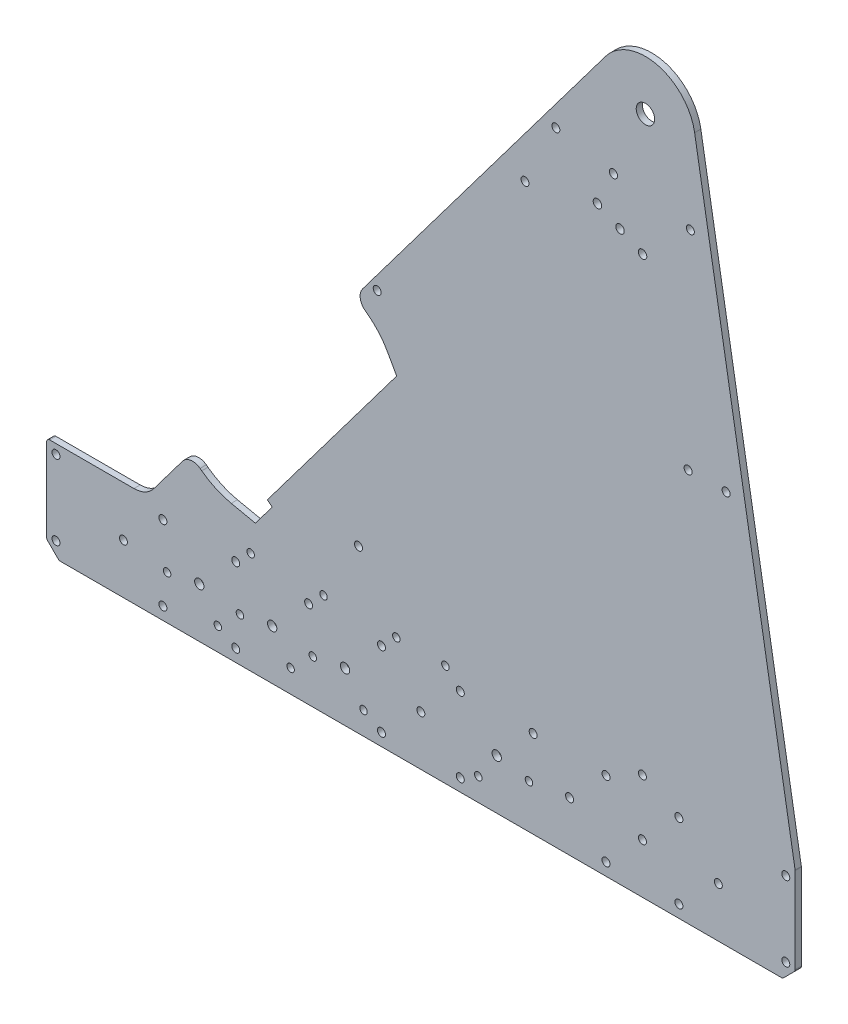
from build123d import *

# Parameters (mm, degrees)
BOSS_EXTRUDE1_DEPTH = 3.175
CUT_EXTRUDE1_REACH  = 534.132
SKETCH2_R           = 2.032
SKETCH5_R           = 2.032
SKETCH5_R_2         = 2.38125
CUT_EXTRUDE4_DEPTH  = 533.132273265
SKETCH6_R           = 2.032
CUT_EXTRUDE5_DEPTH  = 533.132273265
SKETCH3_R           = 4.699
SKETCH3_R_2         = 2.032
SKETCH3_R_3         = 2.0955
SKETCH3_R_4         = 2.159
CUT_EXTRUDE2_DEPTH  = 533.132273265
FILLET1_R           = 1.5875
CUT_EXTRUDE3_REACH  = 534.132
SKETCH4_R           = 1.905
FILLET2_R           = 38.1
FILLET3_R           = 6.35


with BuildPart() as part:
    # Sketch1 → Boss-Extrude1 (new body)
    with BuildSketch(Plane.XY):
        with BuildLine():
            Line((0, 0), (381, 0))
            Line((381, 0), (381, 50.8))
            Line((381, 50.8), (329.837432577, 350.351326687))
            ThreePointArc((329.837432577, 350.351326687), (310.787920632, 370.759100277), (284.504927721, 361.348180455))
            Line((284.504927721, 361.348180455), (157.027492501, 191.955579526))
            Line((157.027492501, 191.955579526), (169.711912675, 182.409841741))
            Line((169.711912675, 182.409841741), (178.167615548, 167.244965001))
            Line((178.167615548, 167.244965001), (112.326505112, 79.754995301))
            Line((112.326505112, 79.754995301), (114.863389147, 77.845847744))
            Line((114.863389147, 77.845847744), (106.272225141, 66.429869588))
            Line((106.272225141, 66.429869588), (85.709420174, 70.786944209))
            Line((85.709420174, 70.786944209), (73.025, 80.332681993))
            Line((73.025, 80.332681993), (54.610499914, 55.863409773))
            ThreePointArc((54.610499914, 55.863409773), (50.133294634, 52.136138511), (44.462963775, 50.8))
            Line((44.462963775, 50.8), (0, 50.8))
            Line((0, 50.8), (0, 0))
        make_face()
    extrude(amount=BOSS_EXTRUDE1_DEPTH)

    # Sketch2 → Cut-Extrude1 (cut, up to next)
    with BuildSketch(Plane.XY.offset(3.175), mode=Mode.PRIVATE) as cut_extrude1_sk1:
        with Locations((4.7625, 46.0375)):
            Circle(SKETCH2_R)
    cut_extrude1_tool1 = extrude(cut_extrude1_sk1.sketch, amount=-CUT_EXTRUDE1_REACH, mode=Mode.PRIVATE) & part.part
    # Sketch2 → Cut-Extrude1 (cut, up to next)
    with BuildSketch(Plane.XY.offset(3.175), mode=Mode.PRIVATE) as cut_extrude1_sk2:
        with Locations((4.7625, 7.9375)):
            Circle(SKETCH2_R)
    cut_extrude1_tool2 = extrude(cut_extrude1_sk2.sketch, amount=-CUT_EXTRUDE1_REACH, mode=Mode.PRIVATE) & part.part
    # Sketch2 → Cut-Extrude1 (cut, up to next)
    with BuildSketch(Plane.XY.offset(3.175), mode=Mode.PRIVATE) as cut_extrude1_sk3:
        with Locations((376.2375, 7.9375)):
            Circle(SKETCH2_R)
    cut_extrude1_tool3 = extrude(cut_extrude1_sk3.sketch, amount=-CUT_EXTRUDE1_REACH, mode=Mode.PRIVATE) & part.part
    # Sketch2 → Cut-Extrude1 (cut, up to next)
    with BuildSketch(Plane.XY.offset(3.175), mode=Mode.PRIVATE) as cut_extrude1_sk4:
        with Locations((376.2375, 46.0375)):
            Circle(SKETCH2_R)
    cut_extrude1_tool4 = extrude(cut_extrude1_sk4.sketch, amount=-CUT_EXTRUDE1_REACH, mode=Mode.PRIVATE) & part.part
    # Sketch2 → Cut-Extrude1 (cut, up to next)
    with BuildSketch(Plane.XY.offset(3.175), mode=Mode.PRIVATE) as cut_extrude1_sk5:
        Polygon((0, 6.35), (0, 0), (6.35, 0), align=None)
    cut_extrude1_tool5 = extrude(cut_extrude1_sk5.sketch, amount=-CUT_EXTRUDE1_REACH, mode=Mode.PRIVATE) & part.part
    # Sketch2 → Cut-Extrude1 (cut, up to next)
    with BuildSketch(Plane.XY.offset(3.175), mode=Mode.PRIVATE) as cut_extrude1_sk6:
        Polygon((381, 0), (374.65, 0), (381, 6.35), align=None)
    cut_extrude1_tool6 = extrude(cut_extrude1_sk6.sketch, amount=-CUT_EXTRUDE1_REACH, mode=Mode.PRIVATE) & part.part
    add(cut_extrude1_tool1.solids().sort_by_distance((4.7625, 46.0375, 3.175))[0], mode=Mode.SUBTRACT)
    add(cut_extrude1_tool2.solids().sort_by_distance((4.7625, 7.9375, 3.175))[0], mode=Mode.SUBTRACT)
    add(cut_extrude1_tool3.solids().sort_by_distance((376.2375, 7.9375, 3.175))[0], mode=Mode.SUBTRACT)
    add(cut_extrude1_tool4.solids().sort_by_distance((376.2375, 46.0375, 3.175))[0], mode=Mode.SUBTRACT)
    add(cut_extrude1_tool5.solids().sort_by_distance((2.116667, 2.116667, 3.175))[0], mode=Mode.SUBTRACT)
    add(cut_extrude1_tool6.solids().sort_by_distance((378.883333, 2.116667, 3.175))[0], mode=Mode.SUBTRACT)

    # Sketch5 → Cut-Extrude4 (cut, through all)
    with BuildSketch(Plane.XY.offset(3.175)):
        with Locations((39.116, 25.4)):
            Circle(SKETCH5_R)
        with Locations((59.182, 6.35)):
            Circle(SKETCH5_R)
        with Locations((59.182, 44.45)):
            Circle(SKETCH5_R)
        with Locations((96.266, 44.45)):
            Circle(SKETCH5_R)
        with Locations((133.35, 44.45)):
            Circle(SKETCH5_R)
        with Locations((170.434, 44.45)):
            Circle(SKETCH5_R)
        with Locations((210.566, 44.45)):
            Circle(SKETCH5_R)
        with Locations((210.566, 6.35)):
            Circle(SKETCH5_R)
        with Locations((170.434, 6.35)):
            Circle(SKETCH5_R)
        with Locations((247.65, 44.45)):
            Circle(SKETCH5_R)
        with Locations((266.192, 25.4)):
            Circle(SKETCH5_R)
        with Locations((77.724, 25.4)):
            Circle(SKETCH5_R_2)
        with Locations((114.808, 25.4)):
            Circle(SKETCH5_R_2)
        with Locations((151.892, 25.4)):
            Circle(SKETCH5_R_2)
        with Locations((229.108, 25.4)):
            Circle(SKETCH5_R_2)
        with Locations((190.5, 25.4)):
            Circle(SKETCH5_R)
        with Locations((303.276, 25.4)):
            Circle(SKETCH5_R)
        with Locations((341.884, 25.4)):
            Circle(SKETCH5_R)
    extrude(amount=-CUT_EXTRUDE4_DEPTH, mode=Mode.SUBTRACT)

    # Sketch6 → Cut-Extrude5 (cut, through all)
    with BuildSketch(Plane.XY.offset(3.175)):
        with Locations((284.734, 44.45)):
            Circle(SKETCH6_R)
        with Locations((284.734, 6.35)):
            Circle(SKETCH6_R)
        with Locations((321.818, 6.35)):
            Circle(SKETCH6_R)
        with Locations((321.818, 44.45)):
            Circle(SKETCH6_R)
        with Locations((96.266, 6.35)):
            Circle(SKETCH6_R)
        with Locations((303.276, 53.975)):
            Circle(SKETCH6_R)
    extrude(amount=-CUT_EXTRUDE5_DEPTH, mode=Mode.SUBTRACT)

    # Sketch3 → Cut-Extrude2 (cut, through all)
    with BuildSketch(Plane.XY.offset(3.175)):
        with Locations((304.8, 346.075)):
            Circle(SKETCH3_R)
        with Locations((168.275, 200.025)):
            Circle(SKETCH3_R_2)
        with Locations((158.75, 82.55)):
            Circle(SKETCH3_R_2)
        with Locations((288.513120591, 311.631603548)):
            Circle(SKETCH3_R_3)
        with Locations((280.369680887, 294.409905322)):
            Circle(SKETCH3_R_4)
        with Locations((291.850813038, 288.98094552)):
            Circle(SKETCH3_R_4)
        with Locations((303.331945188, 283.551985717)):
            Circle(SKETCH3_R_4)
        with Locations((327.675448038, 306.434088454)):
            Circle(SKETCH3_R_2)
        with Locations((345.849836456, 200.025)):
            Circle(SKETCH3_R_2)
        with Locations((259.211844923, 317.178274551)):
            Circle(SKETCH3_R_2)
        with Locations((326.523973131, 200.025)):
            Circle(SKETCH3_R_2)
        with Locations((243.507554531, 285.75)):
            Circle(SKETCH3_R_2)
    extrude(amount=-CUT_EXTRUDE2_DEPTH, mode=Mode.SUBTRACT)

    # Fillet1
    fillet1_edges = [part.edges().sort_by_distance(p)[0] for p in [
        (374.65, 0, 1.5875),
        (381, 6.35, 1.5875),
        (381, 50.8, 1.5875),
        (6.35, 0, 1.5875),
        (0, 6.35, 1.5875),
        (0, 50.8, 1.5875),
    ]]
    fillet(fillet1_edges, radius=FILLET1_R)

    # Sketch4 → Cut-Extrude3 (cut, up to next)
    with BuildSketch(Plane(origin=(0, 0, 0), x_dir=(-1, 0, 0), z_dir=(0, 0, -1)), mode=Mode.PRIVATE) as cut_extrude3_sk1:
        with Locations((-61.318145625, 22.298133105)):
            Circle(SKETCH4_R)
    cut_extrude3_tool1 = extrude(cut_extrude3_sk1.sketch, amount=-CUT_EXTRUDE3_REACH, mode=Mode.PRIVATE) & part.part
    # Sketch4 → Cut-Extrude3 (cut, up to next)
    with BuildSketch(Plane(origin=(0, 0, 0), x_dir=(-1, 0, 0), z_dir=(0, 0, -1)), mode=Mode.PRIVATE) as cut_extrude3_sk2:
        with Locations((-87.131339764, 11.605958005)):
            Circle(SKETCH4_R)
    cut_extrude3_tool2 = extrude(cut_extrude3_sk2.sketch, amount=-CUT_EXTRUDE3_REACH, mode=Mode.PRIVATE) & part.part
    # Sketch4 → Cut-Extrude3 (cut, up to next)
    with BuildSketch(Plane(origin=(0, 0, 0), x_dir=(-1, 0, 0), z_dir=(0, 0, -1)), mode=Mode.PRIVATE) as cut_extrude3_sk3:
        with Locations((-98.402145625, 22.298133105)):
            Circle(SKETCH4_R)
    cut_extrude3_tool3 = extrude(cut_extrude3_sk3.sketch, amount=-CUT_EXTRUDE3_REACH, mode=Mode.PRIVATE) & part.part
    # Sketch4 → Cut-Extrude3 (cut, up to next)
    with BuildSketch(Plane(origin=(0, 0, 0), x_dir=(-1, 0, 0), z_dir=(0, 0, -1)), mode=Mode.PRIVATE) as cut_extrude3_sk4:
        with Locations((-124.215339764, 11.605958005)):
            Circle(SKETCH4_R)
    cut_extrude3_tool4 = extrude(cut_extrude3_sk4.sketch, amount=-CUT_EXTRUDE3_REACH, mode=Mode.PRIVATE) & part.part
    # Sketch4 → Cut-Extrude3 (cut, up to next)
    with BuildSketch(Plane(origin=(0, 0, 0), x_dir=(-1, 0, 0), z_dir=(0, 0, -1)), mode=Mode.PRIVATE) as cut_extrude3_sk5:
        with Locations((-135.486145625, 22.298133105)):
            Circle(SKETCH4_R)
    cut_extrude3_tool5 = extrude(cut_extrude3_sk5.sketch, amount=-CUT_EXTRUDE3_REACH, mode=Mode.PRIVATE) & part.part
    # Sketch4 → Cut-Extrude3 (cut, up to next)
    with BuildSketch(Plane(origin=(0, 0, 0), x_dir=(-1, 0, 0), z_dir=(0, 0, -1)), mode=Mode.PRIVATE) as cut_extrude3_sk6:
        with Locations((-161.299339764, 11.605958005)):
            Circle(SKETCH4_R)
    cut_extrude3_tool6 = extrude(cut_extrude3_sk6.sketch, amount=-CUT_EXTRUDE3_REACH, mode=Mode.PRIVATE) & part.part
    # Sketch4 → Cut-Extrude3 (cut, up to next)
    with BuildSketch(Plane(origin=(0, 0, 0), x_dir=(-1, 0, 0), z_dir=(0, 0, -1)), mode=Mode.PRIVATE) as cut_extrude3_sk7:
        with Locations((-245.513854375, 22.298133105)):
            Circle(SKETCH4_R)
    cut_extrude3_tool7 = extrude(cut_extrude3_sk7.sketch, amount=-CUT_EXTRUDE3_REACH, mode=Mode.PRIVATE) & part.part
    # Sketch4 → Cut-Extrude3 (cut, up to next)
    with BuildSketch(Plane(origin=(0, 0, 0), x_dir=(-1, 0, 0), z_dir=(0, 0, -1)), mode=Mode.PRIVATE) as cut_extrude3_sk8:
        with Locations((-219.700660236, 11.605958005)):
            Circle(SKETCH4_R)
    cut_extrude3_tool8 = extrude(cut_extrude3_sk8.sketch, amount=-CUT_EXTRUDE3_REACH, mode=Mode.PRIVATE) & part.part
    # Sketch4 → Cut-Extrude3 (cut, up to next)
    with BuildSketch(Plane(origin=(0, 0, 0), x_dir=(-1, 0, 0), z_dir=(0, 0, -1)), mode=Mode.PRIVATE) as cut_extrude3_sk9:
        with Locations((-202.981986443, 51.968407021)):
            Circle(SKETCH4_R)
    cut_extrude3_tool9 = extrude(cut_extrude3_sk9.sketch, amount=-CUT_EXTRUDE3_REACH, mode=Mode.PRIVATE) & part.part
    # Sketch4 → Cut-Extrude3 (cut, up to next)
    with BuildSketch(Plane(origin=(0, 0, 0), x_dir=(-1, 0, 0), z_dir=(0, 0, -1)), mode=Mode.PRIVATE) as cut_extrude3_sk10:
        with Locations((-178.018013557, 51.968407021)):
            Circle(SKETCH4_R)
    cut_extrude3_tool10 = extrude(cut_extrude3_sk10.sketch, amount=-CUT_EXTRUDE3_REACH, mode=Mode.PRIVATE) & part.part
    # Sketch4 → Cut-Extrude3 (cut, up to next)
    with BuildSketch(Plane(origin=(0, 0, 0), x_dir=(-1, 0, 0), z_dir=(0, 0, -1)), mode=Mode.PRIVATE) as cut_extrude3_sk11:
        with Locations((-140.934013557, 51.968407021)):
            Circle(SKETCH4_R)
    cut_extrude3_tool11 = extrude(cut_extrude3_sk11.sketch, amount=-CUT_EXTRUDE3_REACH, mode=Mode.PRIVATE) & part.part
    # Sketch4 → Cut-Extrude3 (cut, up to next)
    with BuildSketch(Plane(origin=(0, 0, 0), x_dir=(-1, 0, 0), z_dir=(0, 0, -1)), mode=Mode.PRIVATE) as cut_extrude3_sk12:
        with Locations((-103.850013557, 51.968407021)):
            Circle(SKETCH4_R)
    cut_extrude3_tool12 = extrude(cut_extrude3_sk12.sketch, amount=-CUT_EXTRUDE3_REACH, mode=Mode.PRIVATE) & part.part
    add(cut_extrude3_tool1.solids().sort_by_distance((61.318146, 22.298133, 0))[0], mode=Mode.SUBTRACT)
    add(cut_extrude3_tool2.solids().sort_by_distance((87.13134, 11.605958, 0))[0], mode=Mode.SUBTRACT)
    add(cut_extrude3_tool3.solids().sort_by_distance((98.402146, 22.298133, 0))[0], mode=Mode.SUBTRACT)
    add(cut_extrude3_tool4.solids().sort_by_distance((124.21534, 11.605958, 0))[0], mode=Mode.SUBTRACT)
    add(cut_extrude3_tool5.solids().sort_by_distance((135.486146, 22.298133, 0))[0], mode=Mode.SUBTRACT)
    add(cut_extrude3_tool6.solids().sort_by_distance((161.29934, 11.605958, 0))[0], mode=Mode.SUBTRACT)
    add(cut_extrude3_tool7.solids().sort_by_distance((245.513854, 22.298133, 0))[0], mode=Mode.SUBTRACT)
    add(cut_extrude3_tool8.solids().sort_by_distance((219.70066, 11.605958, 0))[0], mode=Mode.SUBTRACT)
    add(cut_extrude3_tool9.solids().sort_by_distance((202.981986, 51.968407, 0))[0], mode=Mode.SUBTRACT)
    add(cut_extrude3_tool10.solids().sort_by_distance((178.018014, 51.968407, 0))[0], mode=Mode.SUBTRACT)
    add(cut_extrude3_tool11.solids().sort_by_distance((140.934014, 51.968407, 0))[0], mode=Mode.SUBTRACT)
    add(cut_extrude3_tool12.solids().sort_by_distance((103.850014, 51.968407, 0))[0], mode=Mode.SUBTRACT)

    # Fillet2
    fillet2_edges = [part.edges().sort_by_distance(p)[0] for p in [
        (85.709420174, 70.786944209, 1.5875),
        (169.711912675, 182.409841741, 1.5875),
    ]]
    fillet(fillet2_edges, radius=FILLET2_R)

    # Fillet3
    fillet3_edges = [part.edges().sort_by_distance(p)[0] for p in [
        (73.025, 80.332681993, 1.5875),
        (157.027492501, 191.955579526, 1.5875),
    ]]
    fillet(fillet3_edges, radius=FILLET3_R)


solid = part.part
